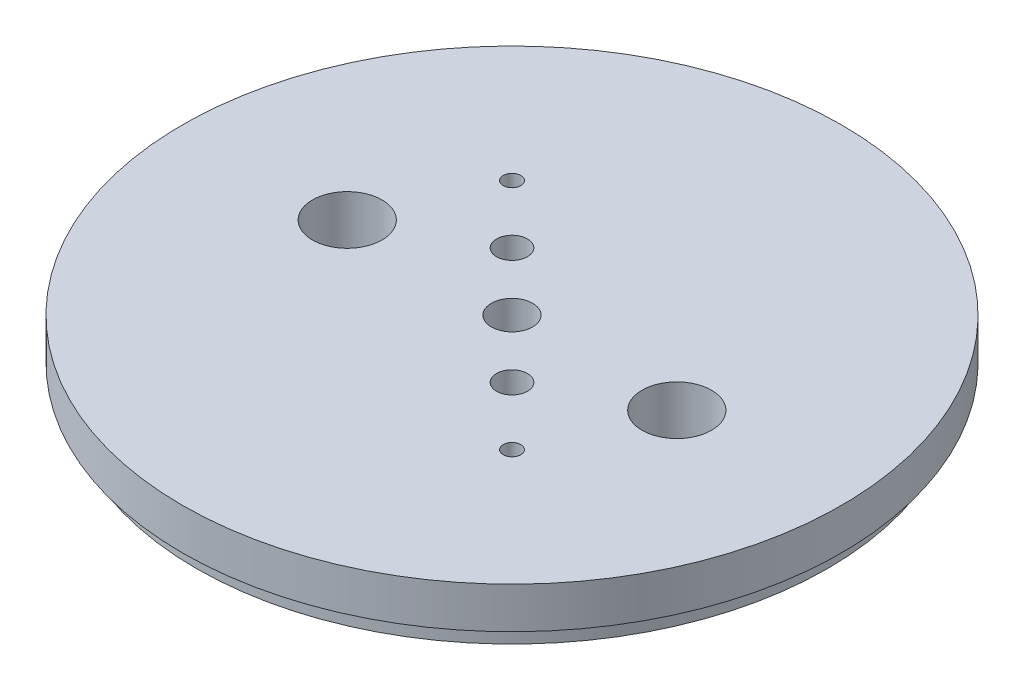
from build123d import *

# Parameters (mm, degrees)
SKETCH1_R           = 50.8
SKETCH1_R_2         = 3.175
SKETCH1_R_3         = 5.3578125
SKETCH1_R_4         = 1.3589
SKETCH1_R_5         = 2.38125
BOSS_EXTRUDE1_DEPTH = 9.525
SKETCH2_R           = 50.8
SKETCH2_R_2         = 48.641
CUT_EXTRUDE1_DEPTH  = 3.175
CUT_EXTRUDE2_START  = -5.969
CUT_EXTRUDE2_DEPTH  = 3.556


with BuildPart() as part:
    # Sketch1 → Boss-Extrude1 (new body)
    with BuildSketch(Plane(origin=(0, 0, 0), x_dir=(1, 0, 0), z_dir=(0, 1, 0))):
        Circle(SKETCH1_R)
        Circle(SKETCH1_R_2, mode=Mode.SUBTRACT)
        with Locations((25.4, 0)):
            Circle(SKETCH1_R_3, mode=Mode.SUBTRACT)
        with Locations((-25.4, 0)):
            Circle(SKETCH1_R_3, mode=Mode.SUBTRACT)
        with Locations((-17.960512242, 17.960512242)):
            Circle(SKETCH1_R_4, mode=Mode.SUBTRACT)
        with Locations((17.960512242, -17.960512242)):
            Circle(SKETCH1_R_4, mode=Mode.SUBTRACT)
        with Locations((-8.980256121, 8.980256121)):
            Circle(SKETCH1_R_5, mode=Mode.SUBTRACT)
        with Locations((8.980256121, -8.980256121)):
            Circle(SKETCH1_R_5, mode=Mode.SUBTRACT)
    extrude(amount=BOSS_EXTRUDE1_DEPTH)

    # Sketch2 → Cut-Extrude1 (cut)
    with BuildSketch(Plane.XZ):
        Circle(SKETCH2_R)
        Circle(SKETCH2_R_2, mode=Mode.SUBTRACT)
    extrude(amount=-CUT_EXTRUDE1_DEPTH, mode=Mode.SUBTRACT)

    # Sketch3 → Cut-Extrude2 (cut)
    with BuildSketch(Plane(origin=(0, 9.525, 0), x_dir=(1, 0, 0), z_dir=(0, 1, 0)).offset(CUT_EXTRUDE2_START)):
        with BuildLine():
            Line((3.2385, 34.798), (3.2385, 13.97))
            ThreePointArc((3.2385, 13.97), (0, 10.7315), (-3.2385, 13.97))
            Line((-3.2385, 13.97), (-3.2385, 34.798))
            ThreePointArc((-3.2385, 34.798), (0, 38.0365), (3.2385, 34.798))
        make_face()
        with BuildLine():
            Line((3.2385, -34.798), (3.2385, -13.97))
            ThreePointArc((3.2385, -13.97), (0, -10.7315), (-3.2385, -13.97))
            Line((-3.2385, -13.97), (-3.2385, -34.798))
            ThreePointArc((-3.2385, -34.798), (0, -38.0365), (3.2385, -34.798))
        make_face()
    extrude(amount=-CUT_EXTRUDE2_DEPTH, mode=Mode.SUBTRACT)


solid = part.part
